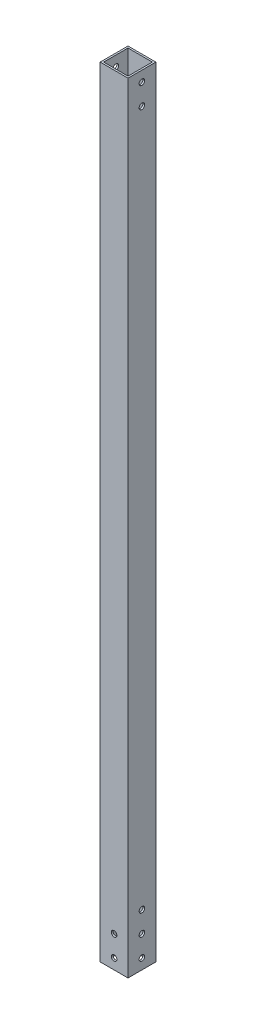
from build123d import *

# Parameters (mm, degrees)
SKETCH1_W           = 25.4
SKETCH1_H           = 25.4
SKETCH1_W_2         = 22.225
SKETCH1_H_2         = 22.225
BOSS_EXTRUDE1_DEPTH = 711.2
SKETCH2_R           = 2.5527
CUT_EXTRUDE1_DEPTH  = 712.766738475
SKETCH3_R           = 2.5527
CUT_EXTRUDE2_DEPTH  = 712.766738475


with BuildPart() as part:
    # Sketch1 → Boss-Extrude1 (new body)
    with BuildSketch(Plane(origin=(0, 0, 0), x_dir=(1, 0, 0), z_dir=(0, 1, 0))):
        Rectangle(SKETCH1_W, SKETCH1_H)
        Rectangle(SKETCH1_W_2, SKETCH1_H_2, mode=Mode.SUBTRACT)
    extrude(amount=BOSS_EXTRUDE1_DEPTH)

    # Sketch2 → Cut-Extrude1 (cut, through all)
    with BuildSketch(Plane.XY.offset(12.7)):
        with Locations((0, 9.525)):
            Circle(SKETCH2_R)
        with Locations((0, 28.575)):
            Circle(SKETCH2_R)
    extrude(amount=-CUT_EXTRUDE1_DEPTH, mode=Mode.SUBTRACT)

    # Sketch3 → Cut-Extrude2 (cut, through all)
    with BuildSketch(Plane(origin=(12.7, 0, 0), x_dir=(0, 0, -1), z_dir=(1, 0, 0))):
        with Locations((0, 9.525)):
            Circle(SKETCH3_R)
        with Locations((0, 28.575)):
            Circle(SKETCH3_R)
        with Locations((0, 47.625)):
            Circle(SKETCH3_R)
        with Locations((0, 701.675)):
            Circle(SKETCH3_R)
        with Locations((0, 682.625)):
            Circle(SKETCH3_R)
    extrude(amount=-CUT_EXTRUDE2_DEPTH, mode=Mode.SUBTRACT)


solid = part.part
